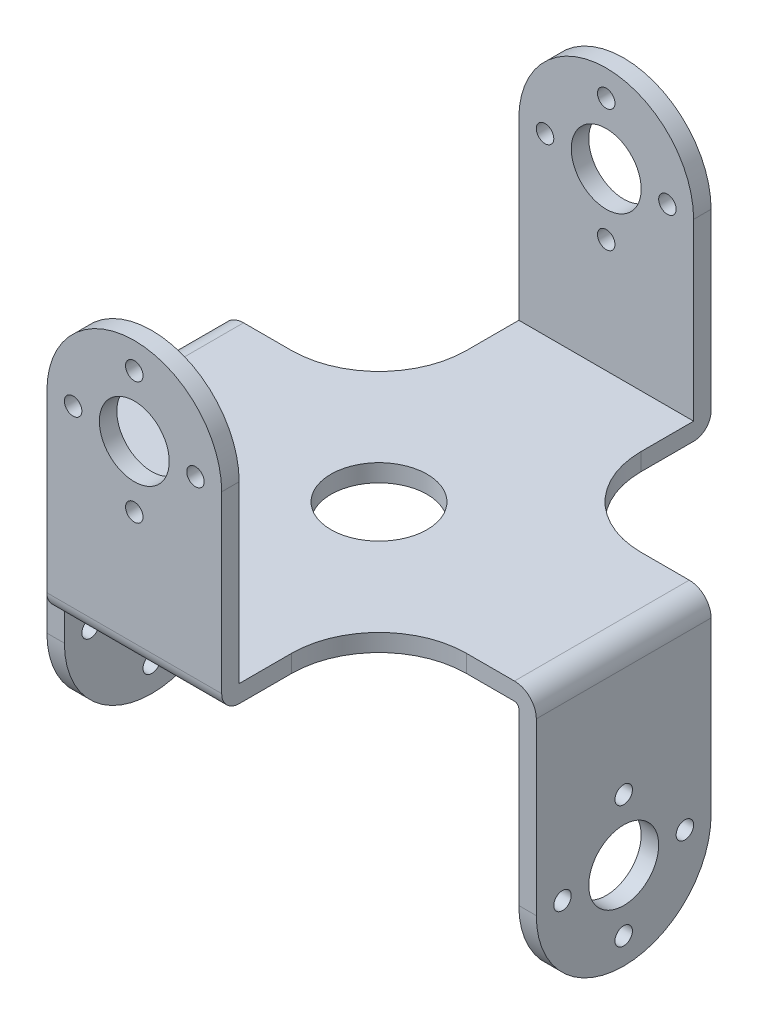
from build123d import *

# Parameters (mm, degrees)
EXTRUDE_START               = -28
EXTRUDE_1_DEPTH             = 38
EXTRUDE_2_DEPTH             = 16
EXTRUDE_3_DEPTH             = 18
EXTRUDE_4_DEPTH             = 2
CUT_EXTRUDE_1_DEPTH         = 20
SKETCH_6_W                  = 16
SKETCH_6_H                  = 22
CUT_EXTRUDE_2_DEPTH         = 2
SKETCH_7_W                  = 2
SKETCH_7_H                  = 22
CUT_EXTRUDE_3_DEPTH         = 16
SKETCH_8_W                  = 16
SKETCH_8_H                  = 22
CUT_EXTRUDE_4_DEPTH         = 16
CUT_EXTRUDE_5_DEPTH         = 18
CUT_EXTRUDE_6_DEPTH         = 16
SKETCH_11_W                 = 16
SKETCH_11_H                 = 22
CUT_EXTRUDE_7_DEPTH         = 16
CUT_EXTRUDE_8_DEPTH         = 20
CUT_EXTRUDE_START           = -16
CUT_EXTRUDE_9_DEPTH         = 16
CUT_EXTRUDE_10_DEPTH        = 16
CUT_EXTRUDE_11_DEPTH        = 20
EXTRUDE_START_2             = 2
EXTRUDE_5_DEPTH             = 2
HOLE_WIZARD_11_0_11_1_D     = 11
HOLE_WIZARD_11_0_11_1_DEPTH = 32
HOLE_WIZARD_8_0_8_1_D       = 8
HOLE_WIZARD_8_0_8_1_DEPTH   = 2
HOLE_WIZARD_2_0_2_1_D       = 2
HOLE_WIZARD_2_0_2_1_DEPTH   = 2
HOLE_WIZARD_8_0_8_2_D       = 8
HOLE_WIZARD_8_0_8_2_DEPTH   = 56
HOLE_WIZARD_2_0_2_2_D       = 2
HOLE_WIZARD_2_0_2_2_DEPTH   = 56
HOLE_WIZARD_8_0_8_3_D       = 8
HOLE_WIZARD_8_0_8_3_DEPTH   = 2
HOLE_WIZARD_2_0_2_3_D       = 2
HOLE_WIZARD_2_0_2_3_DEPTH   = 2
HOLE_WIZARD_8_0_8_4_D       = 8
HOLE_WIZARD_2_0_2_4_D       = 2
FILLET_1_R                  = 0.5
FILLET_2_R                  = 2
FILLET_3_R                  = 2.5
FILLET_4_R                  = 10


with BuildPart() as part:
    # 凸台-拉伸1: read off the stored shape, not the designer's step
    # 凸台-拉伸1 outline → 凸台-拉伸1 (new body)
    with BuildSketch(Plane.XY.offset(EXTRUDE_START)):
        with BuildLine():
            Line((10, -20), (10, 22))
            ThreePointArc((10, 22), (0, 32), (-10, 22))
            Line((-10, 22), (-26, 22))
            Line((-26, 22), (-26, -20))
            Line((-26, -20), (10, -20))
        make_face()
    extrude(amount=EXTRUDE_1_DEPTH)

    # 草图2 → 凸台-拉伸2 (add)
    with BuildSketch(Plane.XY.offset(10)):
        with BuildLine():
            Line((10, 22), (10, -20))
            Line((10, -20), (-26, -20))
            Line((-26, -20), (-26, 22))
            Line((-26, 22), (-10, 22))
            ThreePointArc((-10, 22), (0, 32), (10, 22))
        make_face()
    extrude(amount=EXTRUDE_2_DEPTH)

    # 草图3 → 凸台-拉伸3 (add)
    with BuildSketch(Plane(origin=(10, 0, 0), x_dir=(0, 0, -1), z_dir=(1, 0, 0))):
        with BuildLine():
            Line((-10, -20), (-10, 22))
            Line((-10, 22), (10, 22))
            Line((10, 22), (26, 22))
            Line((26, 22), (28, 22))
            Line((28, 22), (28, -20))
            Line((28, -20), (10, -20))
            ThreePointArc((10, -20), (0, -30), (-10, -20))
        make_face()
    extrude(amount=EXTRUDE_3_DEPTH)

    # 草图4 → 凸台-拉伸4 (add)
    with BuildSketch(Plane.XY.offset(26)):
        with BuildLine():
            Line((10, 22), (10, -20))
            Line((10, -20), (-26, -20))
            Line((-26, -20), (-26, 22))
            Line((-26, 22), (-10, 22))
            ThreePointArc((-10, 22), (0, 32), (10, 22))
        make_face()
    extrude(amount=EXTRUDE_4_DEPTH)

    # 草图5 → 切除-拉伸1 (cut)
    with BuildSketch(Plane.XZ.offset(20)):
        Polygon((-26, 28), (-26, -28), (28, -28), (28, -10), (10, -10), (10, 10), (10, 28), align=None)
    extrude(amount=-CUT_EXTRUDE_1_DEPTH, mode=Mode.SUBTRACT)

    # 草图6 → 切除-拉伸2 (cut)
    with BuildSketch(Plane(origin=(0, 0, -28), x_dir=(-1, 0, 0), z_dir=(0, 0, -1))):
        with Locations((18, 11)):
            Rectangle(SKETCH_6_W, SKETCH_6_H)
    extrude(amount=-CUT_EXTRUDE_2_DEPTH, mode=Mode.SUBTRACT)

    # 草图7 → 切除-拉伸3 (cut)
    with BuildSketch(Plane.ZY.offset(26)):
        with Locations((27, 11)):
            Rectangle(SKETCH_7_W, SKETCH_7_H)
    extrude(amount=-CUT_EXTRUDE_3_DEPTH, mode=Mode.SUBTRACT)

    # 草图8 → 切除-拉伸4 (cut)
    with BuildSketch(Plane(origin=(0, 0, -26), x_dir=(-1, 0, 0), z_dir=(0, 0, -1))):
        with Locations((18, 11)):
            Rectangle(SKETCH_8_W, SKETCH_8_H)
    extrude(amount=-CUT_EXTRUDE_4_DEPTH, mode=Mode.SUBTRACT)

    # 草图9 → 切除-拉伸5 (cut)
    with BuildSketch(Plane(origin=(28, 0, 0), x_dir=(0, 0, -1), z_dir=(1, 0, 0))):
        Polygon((28, 22), (26, 22), (10, 22), (10, 0), (28, 0), align=None)
    extrude(amount=-CUT_EXTRUDE_5_DEPTH, mode=Mode.SUBTRACT)

    # 草图10 → 切除-拉伸6 (cut)
    with BuildSketch(Plane.ZY.offset(-10)):
        with BuildLine():
            Line((-10, 0), (-10, -20))
            ThreePointArc((-10, -20), (0, -30), (10, -20))
            Line((10, -20), (10, 0))
            Line((10, 0), (-10, 0))
        make_face()
    extrude(amount=-CUT_EXTRUDE_6_DEPTH, mode=Mode.SUBTRACT)

    # 草图11 → 切除-拉伸7 (cut)
    with BuildSketch(Plane.XY.offset(26)):
        with Locations((-18, 11)):
            Rectangle(SKETCH_11_W, SKETCH_11_H)
    extrude(amount=-CUT_EXTRUDE_7_DEPTH, mode=Mode.SUBTRACT)

    # 草图12 → 切除-拉伸8 (cut)
    with BuildSketch(Plane(origin=(0, 0, -10), x_dir=(-1, 0, 0), z_dir=(0, 0, -1))):
        with BuildLine():
            Line((-10, 22), (10, 22))
            ThreePointArc((10, 22), (0, 32), (-10, 22))
        make_face()
    extrude(amount=-CUT_EXTRUDE_8_DEPTH, mode=Mode.SUBTRACT)

    # 草图13 → 切除-拉伸9 (cut)
    with BuildSketch(Plane.XY.offset(-10).offset(CUT_EXTRUDE_START)):
        with BuildLine():
            Line((-10, 22), (10, 22))
            ThreePointArc((10, 22), (0, 32), (-10, 22))
        make_face()
    extrude(amount=CUT_EXTRUDE_9_DEPTH, mode=Mode.SUBTRACT)

    # 草图14 → 切除-拉伸10 (cut)
    with BuildSketch(Plane(origin=(0, 0, 10), x_dir=(-1, 0, 0), z_dir=(0, 0, -1))):
        with BuildLine():
            Line((-10, 22), (10, 22))
            ThreePointArc((10, 22), (0, 32), (-10, 22))
        make_face()
    extrude(amount=-CUT_EXTRUDE_10_DEPTH, mode=Mode.SUBTRACT)

    # 草图15 → 切除-拉伸11 (cut)
    with BuildSketch(Plane(origin=(0, 22, 0), x_dir=(-1, 0, 0), z_dir=(0, 1, 0))):
        Polygon((26, -10), (26, 10), (10, 10), (10, 26), (-10, 26), (-10, 10), (-28, 10), (-28, -10), (-10, -10), (-10, -26), (10, -26), (10, -10), align=None)
    extrude(amount=-CUT_EXTRUDE_11_DEPTH, mode=Mode.SUBTRACT)

    # 草图16 → 凸台-拉伸5 (add)
    with BuildSketch(Plane.ZY.offset(26).offset(EXTRUDE_START_2)):
        with BuildLine():
            Line((10, 2), (10, -20))
            ThreePointArc((10, -20), (0, -30), (-10, -20))
            Line((-10, -20), (-10, 2))
            Line((-10, 2), (10, 2))
        make_face()
    extrude(amount=-EXTRUDE_5_DEPTH)

    # Ø11.0 (11) 直径孔1
    with Locations(Plane(origin=(0, 0, 0), x_dir=(-1, 0, 0), z_dir=(0, -1, 0))):
        with Locations((0, 0)):
            Hole(HOLE_WIZARD_11_0_11_1_D / 2, depth=HOLE_WIZARD_11_0_11_1_DEPTH)

    # Ø8.0 (8) 直径孔1
    with Locations(Plane.XY.offset(28)):
        with Locations((0, 22)):
            Hole(HOLE_WIZARD_8_0_8_1_D / 2, depth=HOLE_WIZARD_8_0_8_1_DEPTH)

    # Ø2.0 (2) 直径孔1
    with Locations(Plane.XY.offset(28)):
        with Locations((0, 15), (7, 22), (-7, 22), (0, 29)):
            Hole(HOLE_WIZARD_2_0_2_1_D / 2, depth=HOLE_WIZARD_2_0_2_1_DEPTH)

    # Ø8.0 (8) 直径孔2
    with Locations(Plane(origin=(0, 0, -28), x_dir=(-1, 0, 0), z_dir=(0, 0, -1))):
        with Locations((0, 22)):
            Hole(HOLE_WIZARD_8_0_8_2_D / 2, depth=HOLE_WIZARD_8_0_8_2_DEPTH)

    # Ø2.0 (2) 直径孔2
    with Locations(Plane(origin=(0, 0, -28), x_dir=(-1, 0, 0), z_dir=(0, 0, -1))):
        with Locations((0, 15), (-7, 22), (7, 22), (0, 29)):
            Hole(HOLE_WIZARD_2_0_2_2_D / 2, depth=HOLE_WIZARD_2_0_2_2_DEPTH)

    # Ø8.0 (8) 直径孔3
    with Locations(Plane(origin=(-26, 0, 0), x_dir=(0, 0, -1), z_dir=(1, 0, 0))):
        with Locations((0, -20)):
            Hole(HOLE_WIZARD_8_0_8_3_D / 2, depth=HOLE_WIZARD_8_0_8_3_DEPTH)

    # Ø2.0 (2) 直径孔3
    with Locations(Plane(origin=(-26, 0, 0), x_dir=(0, 0, -1), z_dir=(1, 0, 0))):
        with Locations((0, -13), (0, -27), (7, -20), (-7, -20)):
            Hole(HOLE_WIZARD_2_0_2_3_D / 2, depth=HOLE_WIZARD_2_0_2_3_DEPTH)

    # Ø8.0 (8) 直径孔4 (through all)
    with Locations(Plane.ZY.offset(-26)):
        with Locations((0, -20)):
            Hole(HOLE_WIZARD_8_0_8_4_D / 2)

    # Ø2.0 (2) 直径孔4 (through all)
    with Locations(Plane.ZY.offset(-26)):
        with Locations((0, -13), (0, -27), (-7, -20), (7, -20)):
            Hole(HOLE_WIZARD_2_0_2_4_D / 2)

    # 圆角1
    fillet_1_edges = [part.edges().sort_by_distance(p)[0] for p in [
        (26, 0, 0),
        (-26, 0, 0),
    ]]
    fillet(fillet_1_edges, radius=FILLET_1_R)

    # 圆角2
    fillet_2_edges = [part.edges().sort_by_distance(p)[0] for p in [
        (0, 0, 28),
        (0, 0, -28),
    ]]
    fillet(fillet_2_edges, radius=FILLET_2_R)

    # 圆角3
    fillet_3_edges = [part.edges().sort_by_distance(p)[0] for p in [
        (28, 2, 0),
        (-28, 2, 0),
    ]]
    fillet(fillet_3_edges, radius=FILLET_3_R)

    # 圆角4
    fillet_4_edges = [part.edges().sort_by_distance(p)[0] for p in [
        (-10, 1, 10),
        (10, 1, -10),
        (-10, 1, -10),
        (10, 1, 10),
    ]]
    fillet(fillet_4_edges, radius=FILLET_4_R)


solid = part.part
